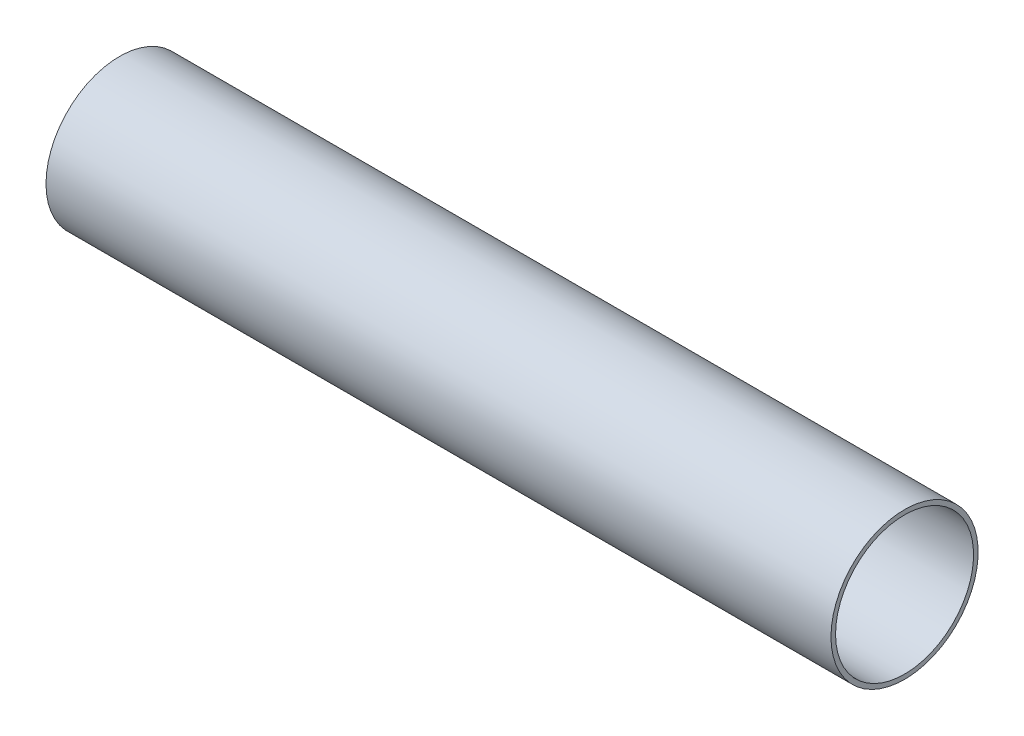
from build123d import *

# Parameters (mm, degrees)
SKETCH1_R           = 14.2875
SKETCH1_R_2         = 13.3985
BOSS_EXTRUDE1_DEPTH = 76.2


with BuildPart() as part:
    # Sketch1 → Boss-Extrude1 (new, symmetric)
    with BuildSketch(Plane(origin=(0, 0, 0), x_dir=(0, 0, -1), z_dir=(1, 0, 0))):
        Circle(SKETCH1_R)
        Circle(SKETCH1_R_2, mode=Mode.SUBTRACT)
    extrude(amount=BOSS_EXTRUDE1_DEPTH, both=True)


solid = part.part
